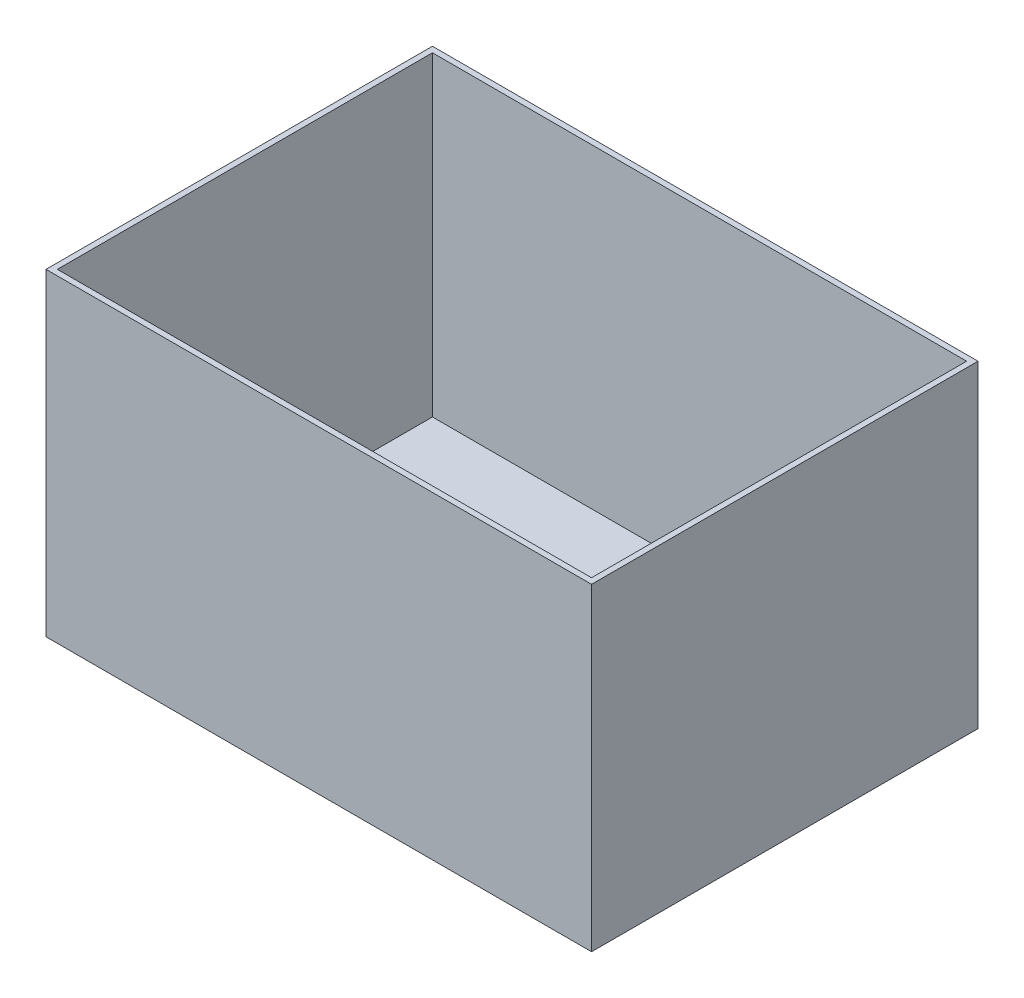
from build123d import *

# Parameters (mm, degrees)
SKETCH1_W           = 298.45
SKETCH1_H           = 209.55
BOSS_EXTRUDE1_DEPTH = 1.5875
SKETCH1_3_W         = 304.8
SKETCH1_3_H         = 215.9
SKETCH1_3_W_2       = 298.45
SKETCH1_3_H_2       = 209.55
BOSS_EXTRUDE2_DEPTH = 177.8


with BuildPart() as part:
    # Sketch1 → Boss-Extrude1 (new, symmetric)
    with BuildSketch(Plane(origin=(0, 0, 0), x_dir=(1, 0, 0), z_dir=(0, 1, 0))):
        Rectangle(SKETCH1_W, SKETCH1_H)
    extrude(amount=BOSS_EXTRUDE1_DEPTH, both=True)

    # Sketch1<3> → Boss-Extrude2 (add)
    with BuildSketch(Plane(origin=(0, 0, 0), x_dir=(1, 0, 0), z_dir=(0, 1, 0))):
        Rectangle(SKETCH1_3_W, SKETCH1_3_H)
        Rectangle(SKETCH1_3_W_2, SKETCH1_3_H_2, mode=Mode.SUBTRACT)
    extrude(amount=BOSS_EXTRUDE2_DEPTH)


solid = part.part
